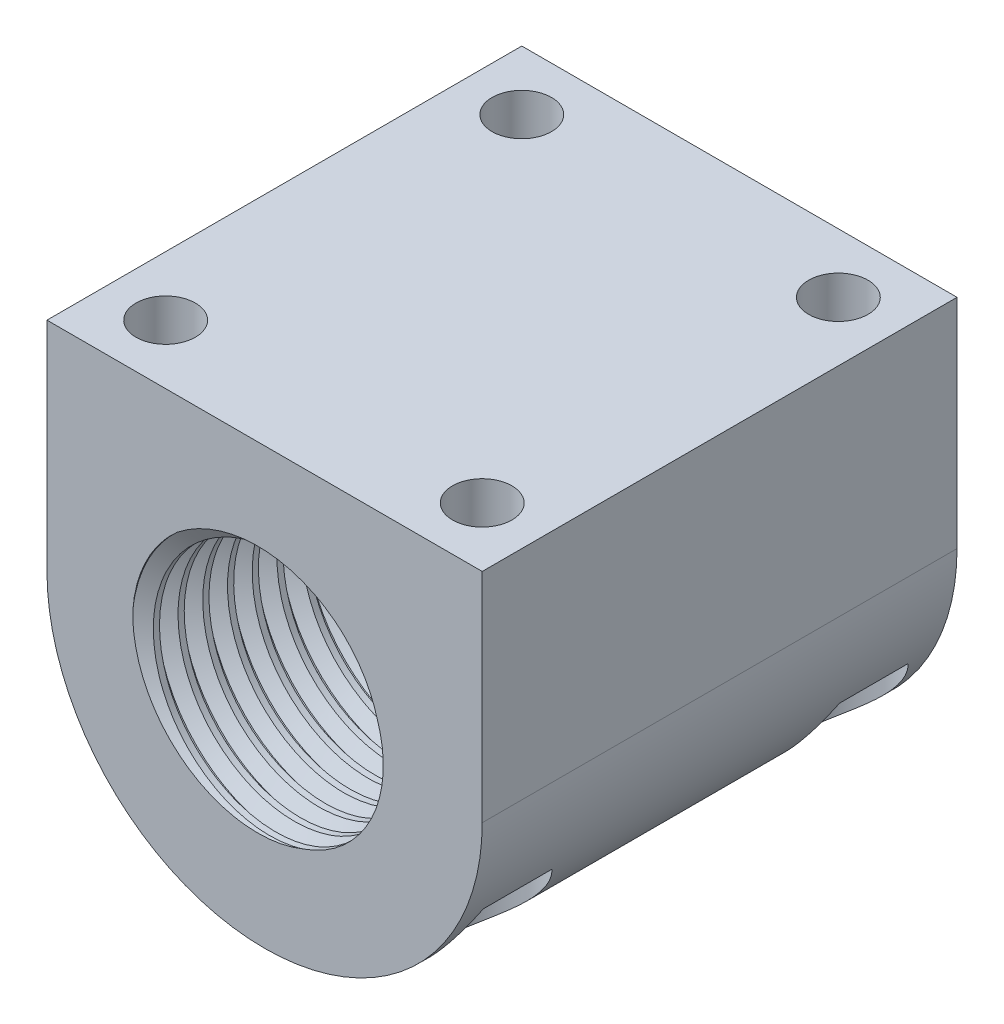
from build123d import *

# Parameters (mm, degrees)
ESQUISSE1_R             = 11
ESQUISSE1_R_2           = 6
BOSS_EXTRU_1_DEPTH      = 24
FILETAGE1_PITCH         = 1.25
ESQUISSE5_R             = 1.5
ENL_V_MAT_EXTRU_1_DEPTH = 35.365680721
ENL_V_START             = -16
ESQUISSE5_3_R           = 2.5
ESQUISSE5_3_R_2         = 1.5
ENL_V_MAT_EXTRU_2_DEPTH = 5


with BuildPart() as part:
    # Esquisse1 → Boss.-Extru.1 (new body)
    # profile 1 of 3: a face of its own
    with BuildSketch(Plane.XY):
        with BuildLine():
            Line((-11, 11), (-11, 0))
            ThreePointArc((-11, 0), (-7.778174593, 7.778174593), (0, 11))
            Line((0, 11), (-11, 11))
        make_face()
    # profile 2 of 3: a face of its own
    with BuildSketch(Plane.XY):
        with BuildLine():
            ThreePointArc((0, 11), (7.778174593, 7.778174593), (11, 0))
            Line((11, 0), (11, 11))
            Line((11, 11), (0, 11))
        make_face()
    # profile 3 of 3: a face of its own
    with BuildSketch(Plane.XY):
        Circle(ESQUISSE1_R)
        Circle(ESQUISSE1_R_2, mode=Mode.SUBTRACT)
    extrude(amount=BOSS_EXTRU_1_DEPTH)

    # Filetage1: the profile of Profil de filetage1 profile screwed along a right-hand helix of 20.8 turns, 8 arcs to a turn; built about Z, then put on its axis
    filetage1_z = Axis((0, 0, 0), (0, 0, 1))
    filetage1_corners = [(5.9997, 3e-09, -0.000173205), (6.676582344, 3e-09, 0.390624998), (6.676582344, 3e-09, 0.546874998), (5.9997, 3e-09, 0.937673202)]
    with BuildLine(mode=Mode.PRIVATE) as filetage1_profile:
        Line(filetage1_corners[0], filetage1_corners[1])
        Line(filetage1_corners[1], filetage1_corners[2])
        Line(filetage1_corners[2], filetage1_corners[3])
        Line(filetage1_corners[3], filetage1_corners[0])
    filetage1_cap = Face(filetage1_profile.wire())
    filetage1_turn_angles = [0, 22.5, 45, 67.5, 90, 112.5, 135, 157.5, 180, 202.5, 225, 247.5, 270, 292.5, 315, 337.5, 360]
    filetage1_turn_weights = [1, 0.9238795325112867, 1, 0.9238795325112867, 1, 0.9238795325112867, 1, 0.9238795325112867, 1, 0.9238795325112867, 1, 0.9238795325112867, 1, 0.9238795325112867, 1, 0.9238795325112867, 1]
    filetage1_turn_rails = [Edge.make_bspline([Vector(p[0], p[1], 0).rotate(filetage1_z, filetage1_turn_angles[k]) / filetage1_turn_weights[k] + Vector(0, 0, p[2] + FILETAGE1_PITCH * filetage1_turn_angles[k] / 360) for k in range(17)], [0, 0, 0, 1, 1, 2, 2, 3, 3, 4, 4, 5, 5, 6, 6, 7, 7, 8, 8, 8], 2, filetage1_turn_weights) for p in filetage1_corners]
    filetage1_turn_sides = [Face.make_surface_from_curves(filetage1_turn_rails[p[0]], filetage1_turn_rails[p[1]]) for p in [(0, 1), (1, 2), (2, 3), (3, 0)]]
    filetage1_last_angles = [7200, 7222.5, 7245, 7267.5, 7290, 7312.5, 7335, 7357.5, 7380, 7402.5, 7425, 7447.5, 7470, 7479, 7488]
    filetage1_last_weights = [1, 0.9238795325112867, 1, 0.9238795325112867, 1, 0.9238795325112867, 1, 0.9238795325112867, 1, 0.9238795325112867, 1, 0.9238795325112867, 1, 0.9876883405951352, 1]
    filetage1_last_rails = [Edge.make_bspline([Vector(p[0], p[1], 0).rotate(filetage1_z, filetage1_last_angles[k]) / filetage1_last_weights[k] + Vector(0, 0, p[2] + FILETAGE1_PITCH * filetage1_last_angles[k] / 360) for k in range(15)], [0, 0, 0, 1, 1, 2, 2, 3, 3, 4, 4, 5, 5, 6, 6, 7, 7, 7], 2, filetage1_last_weights) for p in filetage1_corners]
    filetage1_last_sides = [Face.make_surface_from_curves(filetage1_last_rails[p[0]], filetage1_last_rails[p[1]]) for p in [(0, 1), (1, 2), (2, 3), (3, 0)]]
    filetage1 = Plane(origin=(0, 0, -2), x_dir=(0.999847695, 0.017452406, 0), z_dir=(0, 0, 1)) * Solid(Shell([*[p.moved(Location((0, 0, FILETAGE1_PITCH * i))) for i in range(20) for p in filetage1_turn_sides], *filetage1_last_sides, filetage1_cap, filetage1_cap.rotate(filetage1_z, 7488).moved(Location((0, 0, FILETAGE1_PITCH * 7488 / 360)))]))
    add(filetage1, mode=Mode.SUBTRACT)

    # Esquisse5 → Enlèv. mat.-Extru.1 (cut, through all)
    with BuildSketch(Plane(origin=(0, 11, 0), x_dir=(1, 0, 0), z_dir=(0, 1, 0))):
        with Locations(Location((-8, -21, 0), (0, 0, 270))):
            Circle(ESQUISSE5_R)
        with Locations(Location((8, -21, 0), (0, 0, 270))):
            Circle(ESQUISSE5_R)
        with Locations(Location((8, -3, 0), (0, 0, 270))):
            Circle(ESQUISSE5_R)
        with Locations(Location((-8, -3, 0), (0, 0, 270))):
            Circle(ESQUISSE5_R)
    extrude(amount=-ENL_V_MAT_EXTRU_1_DEPTH, mode=Mode.SUBTRACT)

    # Esquisse5<3> → Enlèv. mat.-Extru.2 (cut)
    # profile 1 of 4: a face of its own
    with BuildSketch(Plane(origin=(0, 11, 0), x_dir=(1, 0, 0), z_dir=(0, 1, 0)).offset(ENL_V_START)):
        with Locations((-8, -3)):
            Circle(ESQUISSE5_3_R)
        with Locations(Location((-8, -3, 0), (0, 0, 270))):
            Circle(ESQUISSE5_3_R_2, mode=Mode.SUBTRACT)
    # profile 2 of 4: a face of its own
    with BuildSketch(Plane(origin=(0, 11, 0), x_dir=(1, 0, 0), z_dir=(0, 1, 0)).offset(ENL_V_START)):
        with Locations((8, -3)):
            Circle(ESQUISSE5_3_R)
        with Locations(Location((8, -3, 0), (0, 0, 270))):
            Circle(ESQUISSE5_3_R_2, mode=Mode.SUBTRACT)
    # profile 3 of 4: a face of its own
    with BuildSketch(Plane(origin=(0, 11, 0), x_dir=(1, 0, 0), z_dir=(0, 1, 0)).offset(ENL_V_START)):
        with Locations((8, -21)):
            Circle(ESQUISSE5_3_R)
        with Locations(Location((8, -21, 0), (0, 0, 270))):
            Circle(ESQUISSE5_3_R_2, mode=Mode.SUBTRACT)
    # profile 4 of 4: a face of its own
    with BuildSketch(Plane(origin=(0, 11, 0), x_dir=(1, 0, 0), z_dir=(0, 1, 0)).offset(ENL_V_START)):
        with Locations((-8, -21)):
            Circle(ESQUISSE5_3_R)
        with Locations(Location((-8, -21, 0), (0, 0, 270))):
            Circle(ESQUISSE5_3_R_2, mode=Mode.SUBTRACT)
    extrude(amount=-ENL_V_MAT_EXTRU_2_DEPTH, mode=Mode.SUBTRACT)


solid = part.part
